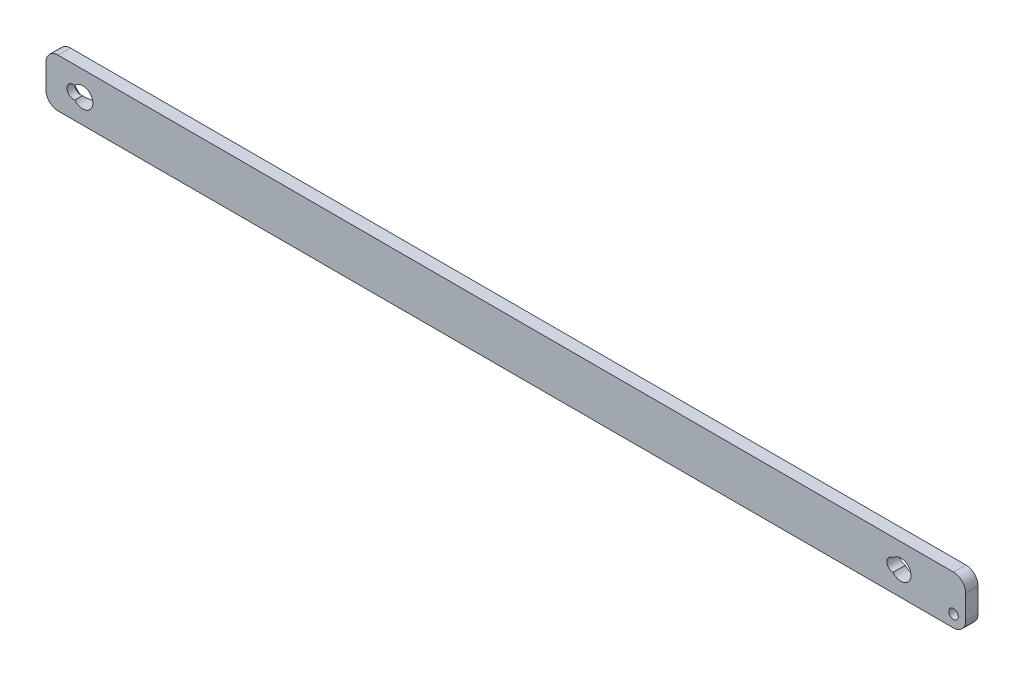
from build123d import *

# Parameters (mm, degrees)
SKETCH1_R                                           = 2.4892
SKETCH1_R_2                                         = 5.283709008
BOSS_EXTRUDE1_DEPTH                                 = 6.477
FILLET2_R                                           = 6.35
SKETCH2_R                                           = 3.2639
CUT_EXTRUDE1_DEPTH                                  = 484.441543639
CSK_FOR_1_4_FLAT_HEAD_MACHINE_SCREW_100_D           = 6.7564
CSK_FOR_1_4_FLAT_HEAD_MACHINE_SCREW_100_DEPTH       = 19.05
CSK_FOR_1_4_FLAT_HEAD_MACHINE_SCREW_100_CSINK_D     = 12.8778
CSK_FOR_1_4_FLAT_HEAD_MACHINE_SCREW_100_CSINK_ANGLE = 100
CSK_FOR_1_4_FLAT_HEAD_MACHINE_SCREW_100_TIP         = 2.029827343


with BuildPart() as part:
    # Sketch1 → Boss-Extrude1 (new body)
    with BuildSketch(Plane.XY):
        Polygon((0, 25.4), (0, 0), (40.53078, 0), (343.71026, 0), (482.6, 0), (482.6, 25.4), (40.530665192, 25.4), align=None)
        with Locations((476.25, 6.35)):
            Circle(SKETCH1_R, mode=Mode.SUBTRACT)
        with Locations((19.319590251, 12.7)):
            Circle(SKETCH1_R_2, mode=Mode.SUBTRACT)
        with Locations((448.642067934, 12.7)):
            Circle(SKETCH1_R_2, mode=Mode.SUBTRACT)
    extrude(amount=BOSS_EXTRUDE1_DEPTH)

    # Fillet2
    fillet2_edges = [part.edges().sort_by_distance(p)[0] for p in [
        (482.6, 25.4, 3.2385),
        (482.6, 0, 3.2385),
        (0, 0, 3.2385),
        (0, 25.4, 3.2385),
    ]]
    fillet(fillet2_edges, radius=FILLET2_R)


with BuildPart() as body_2:
    # Mirror2: mirrored copy
    add(part.part.mirror(Plane.XY))

    # Sketch2 → Cut-Extrude1 (cut, through all)
    with BuildSketch(Plane.XY.offset(6.477)):
        with Locations((444.5, 12.7)):
            Circle(SKETCH2_R)
    extrude(amount=-CUT_EXTRUDE1_DEPTH, mode=Mode.SUBTRACT)

    # CSK for 1/4 Flat Head Machine Screw (100)1
    with Locations(Plane(origin=(0, 0, -6.477), x_dir=(1, 0, 0), z_dir=(0, 0, -1))):
        with Locations((14.393926, -12.7)):
            CounterSinkHole(CSK_FOR_1_4_FLAT_HEAD_MACHINE_SCREW_100_D / 2, CSK_FOR_1_4_FLAT_HEAD_MACHINE_SCREW_100_CSINK_D / 2, depth=CSK_FOR_1_4_FLAT_HEAD_MACHINE_SCREW_100_DEPTH, counter_sink_angle=CSK_FOR_1_4_FLAT_HEAD_MACHINE_SCREW_100_CSINK_ANGLE)
            with Locations((0, 0, -(CSK_FOR_1_4_FLAT_HEAD_MACHINE_SCREW_100_DEPTH + CSK_FOR_1_4_FLAT_HEAD_MACHINE_SCREW_100_TIP / 2))):  # 118° drill point
                Cone(0, CSK_FOR_1_4_FLAT_HEAD_MACHINE_SCREW_100_D / 2, CSK_FOR_1_4_FLAT_HEAD_MACHINE_SCREW_100_TIP, mode=Mode.SUBTRACT)


solid = body_2.part
